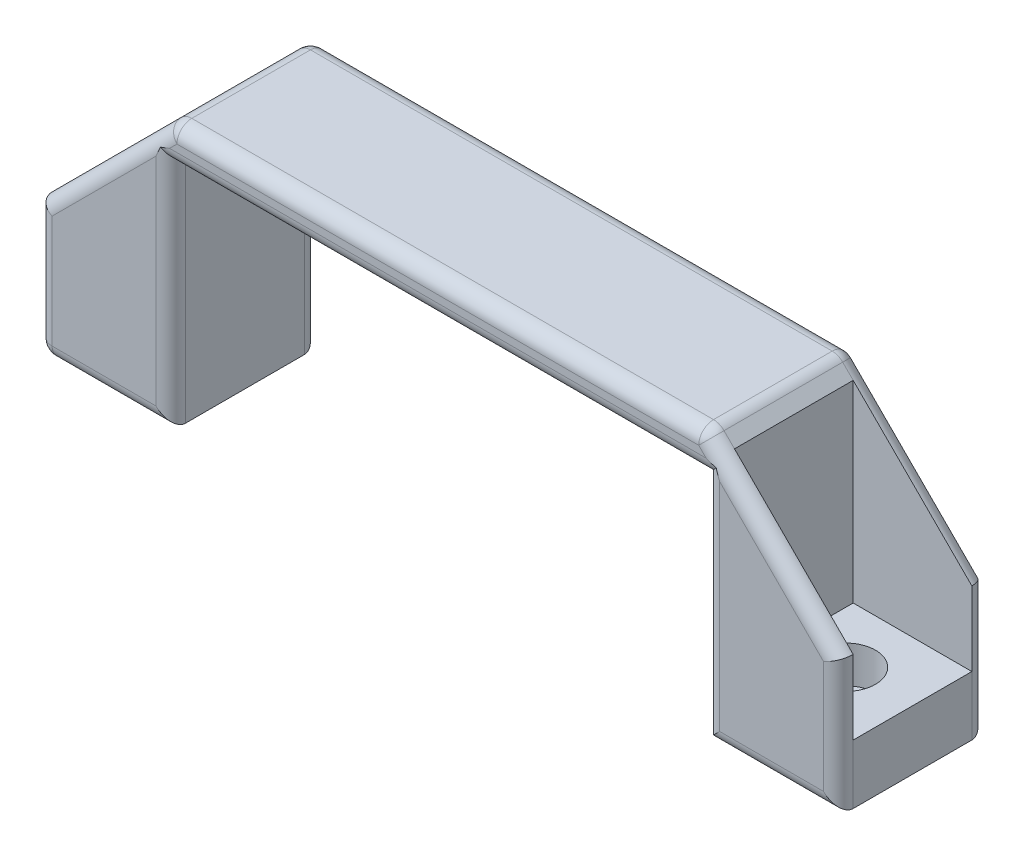
from build123d import *

# Parameters (mm, degrees)
EXTRUDE_1_DEPTH     = 10
SKETCH_2_R          = 2.15
CUT_EXTRUDE_1_DEPTH = 66.665820638
CUT_EXTRUDE_START   = -8
SKETCH_3_W          = 16
SKETCH_3_H          = 16
CUT_EXTRUDE_2_DEPTH = 58.665820638
SKETCH_4_R          = 4
CUT_EXTRUDE_3_DEPTH = 5
FILLET_1_R          = 2


with BuildPart() as part:
    # 草图1 → 凸台-拉伸1 (new, symmetric)
    with BuildSketch(Plane.XY):
        Polygon((-54, 0), (-54, 18), (-36, 36), (36, 36), (54, 18), (54, 0), (36, 0), (36, 31), (-36, 31), (-36, 0), align=None)
    extrude(amount=EXTRUDE_1_DEPTH, both=True)

    # 草图2 → 切除-拉伸1 (cut, through all)
    with BuildSketch(Plane(origin=(0, 0, 0), x_dir=(1, 0, 0), z_dir=(0, 1, 0))):
        with Locations(Location((-45, 0, 0), (0, 0, 180))):
            Circle(SKETCH_2_R)
        with Locations(Location((45, 0, 0), (0, 0, 90))):
            Circle(SKETCH_2_R)
    extrude(amount=CUT_EXTRUDE_1_DEPTH, mode=Mode.SUBTRACT)

    # 草图3 → 切除-拉伸2 (cut, through all)
    with BuildSketch(Plane.XZ.offset(CUT_EXTRUDE_START)):
        with Locations((-46, 0)):
            Rectangle(SKETCH_3_W, SKETCH_3_H)
        with Locations((46, 0)):
            Rectangle(SKETCH_3_W, SKETCH_3_H)
    extrude(amount=-CUT_EXTRUDE_2_DEPTH, mode=Mode.SUBTRACT)

    # 草图4 → 切除-拉伸3 (cut)
    with BuildSketch(Plane(origin=(0, 8, 0), x_dir=(1, 0, 0), z_dir=(0, 1, 0))):
        with Locations(Location((45, 0, 0), (0, 0, 270))):
            Circle(SKETCH_4_R)
        with Locations(Location((-45, 0, 0), (0, 0, 270))):
            Circle(SKETCH_4_R)
    extrude(amount=-CUT_EXTRUDE_3_DEPTH, mode=Mode.SUBTRACT)

    # 圆角1
    # the kernel refuses this fillet: 2 mm, written as the material it takes off along each edge
    with BuildSketch(Plane(origin=(-52, 2, 8), x_dir=(0, -1, 0), z_dir=(-1, 0, 0))) as fillet_1_piece_1_section:
        Polygon((0, 0), (FILLET_1_R, 0), (FILLET_1_R, FILLET_1_R), (0, FILLET_1_R), align=None)
    fillet_1_piece_1 = extrude(amount=FILLET_1_R, mode=Mode.PRIVATE)
    fillet_1_piece_1 = fillet_1_piece_1 - Plane(origin=(-52, 2, 8), x_dir=(0, 0.7071067811865475, -0.7071067811865475), z_dir=(-1, 0, 0)) * Sphere(FILLET_1_R, mode=Mode.PRIVATE)
    add(fillet_1_piece_1, mode=Mode.SUBTRACT)
    with BuildSketch(Plane(origin=(-35.171572875, 34, 8), x_dir=(-0.7071067811865515, 0.7071067811865437, 0), z_dir=(0, 0, 1))) as fillet_1_piece_2_section:
        Polygon((0, 0), (FILLET_1_R, 0), (FILLET_1_R, -FILLET_1_R * 0.414213562373), (FILLET_1_R * 0.707106781187, -FILLET_1_R * 0.707106781187), align=None)
    fillet_1_piece_2 = extrude(amount=FILLET_1_R, mode=Mode.PRIVATE)
    fillet_1_piece_2 = fillet_1_piece_2 - Plane(origin=(-35.171572875, 34, 8), x_dir=(0.38268343236509234, -0.9238795325112857, 0), z_dir=(0, 0, 1)) * Sphere(FILLET_1_R, mode=Mode.PRIVATE)
    add(fillet_1_piece_2, mode=Mode.SUBTRACT)
    with BuildSketch(Plane(origin=(35.171572875, 34, 8), x_dir=(0.7071067811865515, 0.7071067811865437, 0), z_dir=(0, 0, 1))) as fillet_1_piece_3_section:
        Polygon((0, 0), (FILLET_1_R, 0), (FILLET_1_R, FILLET_1_R * 0.414213562373), (FILLET_1_R * 0.707106781187, FILLET_1_R * 0.707106781187), align=None)
    fillet_1_piece_3 = extrude(amount=FILLET_1_R, mode=Mode.PRIVATE)
    fillet_1_piece_3 = fillet_1_piece_3 - Plane(origin=(35.171572875, 34, 8), x_dir=(-0.38268343236509234, -0.9238795325112857, 0), z_dir=(0, 0, 1)) * Sphere(FILLET_1_R, mode=Mode.PRIVATE)
    add(fillet_1_piece_3, mode=Mode.SUBTRACT)
    with BuildSketch(Plane(origin=(35.171572875, 34, -8), x_dir=(0, 1, 0), z_dir=(0, 0, -1))) as fillet_1_piece_4_section:
        Polygon((0, 0), (FILLET_1_R, 0), (FILLET_1_R, FILLET_1_R * 0.414213562373), (FILLET_1_R * 0.707106781187, FILLET_1_R * 0.707106781187), align=None)
    fillet_1_piece_4 = extrude(amount=FILLET_1_R, mode=Mode.PRIVATE)
    fillet_1_piece_4 = fillet_1_piece_4 - Plane(origin=(35.171572875, 34, -8), x_dir=(-0.38268343236509234, -0.9238795325112857, 0), z_dir=(0, 0, -1)) * Sphere(FILLET_1_R, mode=Mode.PRIVATE)
    add(fillet_1_piece_4, mode=Mode.SUBTRACT)
    with BuildSketch(Plane(origin=(-35.171572875, 34, -8), x_dir=(0, 1, 0), z_dir=(0, 0, -1))) as fillet_1_piece_5_section:
        Polygon((0, 0), (FILLET_1_R, 0), (FILLET_1_R, -FILLET_1_R * 0.414213562373), (FILLET_1_R * 0.707106781187, -FILLET_1_R * 0.707106781187), align=None)
    fillet_1_piece_5 = extrude(amount=FILLET_1_R, mode=Mode.PRIVATE)
    fillet_1_piece_5 = fillet_1_piece_5 - Plane(origin=(-35.171572875, 34, -8), x_dir=(0.38268343236509234, -0.9238795325112857, 0), z_dir=(0, 0, -1)) * Sphere(FILLET_1_R, mode=Mode.PRIVATE)
    add(fillet_1_piece_5, mode=Mode.SUBTRACT)
    with BuildSketch(Plane(origin=(-52, 2, -8), x_dir=(0, -1, 0), z_dir=(-1, 0, 0))) as fillet_1_piece_6_section:
        Polygon((0, 0), (FILLET_1_R, 0), (FILLET_1_R, -FILLET_1_R), (0, -FILLET_1_R), align=None)
    fillet_1_piece_6 = extrude(amount=FILLET_1_R, mode=Mode.PRIVATE)
    fillet_1_piece_6 = fillet_1_piece_6 - Plane(origin=(-52, 2, -8), x_dir=(0, 0.7071067811865475, 0.7071067811865475), z_dir=(-1, 0, 0)) * Sphere(FILLET_1_R, mode=Mode.PRIVATE)
    add(fillet_1_piece_6, mode=Mode.SUBTRACT)
    with BuildSketch(Plane(origin=(-54, 2, 10), x_dir=(0, 0, -1), z_dir=(0, 1, 0)), Plane(origin=(-31, 0, 10), x_dir=(0, 0, -1), z_dir=(-1, 0, 0))) as fillet_1_piece_7:
        with BuildLine():
            CenterArc((FILLET_1_R, -FILLET_1_R), FILLET_1_R, 90, 90)
            Line((0, -FILLET_1_R), (0, 0))
            Line((0, 0), (FILLET_1_R, 0))
        make_face()
    extrude(amount=21, mode=Mode.SUBTRACT)
    with BuildSketch(Plane(origin=(-57.535533906, 14.464466094, 10), x_dir=(0.7071067811865515, -0.7071067811865437, 0), z_dir=(0.7071067811865437, 0.7071067811865515, 0)), Plane(origin=(36.585786438, 35.414213562, 10), x_dir=(-0.7071067811865515, -0.7071067811865437, 0), z_dir=(0.7071067811865437, -0.7071067811865515, 0)), Plane(origin=(-57.535533906, 14.464466094, -10), x_dir=(0, 0, 1), z_dir=(0.7071067811865437, 0.7071067811865515, 0))) as fillet_1_piece_8:
        with BuildLine():
            CenterArc((FILLET_1_R, FILLET_1_R), FILLET_1_R, 180, 90)
            Line((0, FILLET_1_R), (0, 0))
            Line((0, 0), (FILLET_1_R, 0))
        make_face()
    extrude(amount=29.627416998, mode=Mode.SUBTRACT)
    with BuildSketch(Plane(origin=(54, 23, 10), x_dir=(-1, 0, 0), z_dir=(0, -1, 0)), Plane(origin=(59, 0, 10), x_dir=(0, 1, 0), z_dir=(-1, 0, 0))) as fillet_1_piece_9:
        with BuildLine():
            CenterArc((FILLET_1_R, FILLET_1_R), FILLET_1_R, 180, 90)
            Line((0, FILLET_1_R), (0, 0))
            Line((0, 0), (FILLET_1_R, 0))
        make_face()
    extrude(amount=28, mode=Mode.SUBTRACT)
    with BuildSketch(Plane(origin=(36, -5, 10), x_dir=(1, 0, 0), z_dir=(0, 1, 0)), Plane(origin=(-36, 31, 10), x_dir=(-1, 0, 0), z_dir=(0, -1, 0))) as fillet_1_piece_10:
        with BuildLine():
            CenterArc((FILLET_1_R, FILLET_1_R), FILLET_1_R, 180, 90)
            Line((0, FILLET_1_R), (0, 0))
            Line((0, 0), (FILLET_1_R, 0))
        make_face()
    extrude(amount=36, mode=Mode.SUBTRACT)
    with BuildSketch(Plane(origin=(36, 31, 10), x_dir=(0, 1, 0), z_dir=(-1, 0, 0))) as fillet_1_piece_11:
        with BuildLine():
            CenterArc((FILLET_1_R, FILLET_1_R), FILLET_1_R, 180, 90)
            Line((0, FILLET_1_R), (0, 0))
            Line((0, 0), (FILLET_1_R, 0))
        make_face()
    extrude(amount=72, mode=Mode.SUBTRACT)
    with BuildSketch(Plane(origin=(-36, 31, -10), x_dir=(-1, 0, 0), z_dir=(0, -1, 0)), Plane(origin=(36, -5, -10), x_dir=(1, 0, 0), z_dir=(0, 1, 0))) as fillet_1_piece_12:
        with BuildLine():
            CenterArc((FILLET_1_R, -FILLET_1_R), FILLET_1_R, 90, 90)
            Line((0, -FILLET_1_R), (0, 0))
            Line((0, 0), (FILLET_1_R, 0))
        make_face()
    extrude(amount=36, mode=Mode.SUBTRACT)
    with BuildSketch(Plane(origin=(36, 31, -10), x_dir=(0, 1, 0), z_dir=(-1, 0, 0))) as fillet_1_piece_13:
        with BuildLine():
            CenterArc((FILLET_1_R, -FILLET_1_R), FILLET_1_R, 90, 90)
            Line((0, -FILLET_1_R), (0, 0))
            Line((0, 0), (FILLET_1_R, 0))
        make_face()
    extrude(amount=72, mode=Mode.SUBTRACT)
    with BuildSketch(Plane(origin=(59, 0, -10), x_dir=(0, 1, 0), z_dir=(-1, 0, 0)), Plane(origin=(54, 23, -10), x_dir=(-1, 0, 0), z_dir=(0, -1, 0))) as fillet_1_piece_14:
        with BuildLine():
            CenterArc((FILLET_1_R, -FILLET_1_R), FILLET_1_R, 90, 90)
            Line((0, -FILLET_1_R), (0, 0))
            Line((0, 0), (FILLET_1_R, 0))
        make_face()
    extrude(amount=28, mode=Mode.SUBTRACT)
    with BuildSketch(Plane(origin=(36.585786438, 35.414213562, -10), x_dir=(-0.7071067811865515, -0.7071067811865437, 0), z_dir=(0.7071067811865437, -0.7071067811865515, 0))) as fillet_1_piece_15:
        with BuildLine():
            CenterArc((FILLET_1_R, -FILLET_1_R), FILLET_1_R, 90, 90)
            Line((0, -FILLET_1_R), (0, 0))
            Line((0, 0), (FILLET_1_R, 0))
        make_face()
    extrude(amount=29.627416998, mode=Mode.SUBTRACT)
    with BuildSketch(Plane(origin=(-54, 2, -10), x_dir=(0, 0, 1), z_dir=(0, 1, 0)), Plane(origin=(-31, 0, -10), x_dir=(0, 0, 1), z_dir=(-1, 0, 0))) as fillet_1_piece_16:
        with BuildLine():
            CenterArc((FILLET_1_R, FILLET_1_R), FILLET_1_R, 180, 90)
            Line((0, FILLET_1_R), (0, 0))
            Line((0, 0), (FILLET_1_R, 0))
        make_face()
    extrude(amount=21, mode=Mode.SUBTRACT)
    with BuildSketch(Plane(origin=(36, 36, 8), x_dir=(-1, 0, 0), z_dir=(0, 0, -1)), Plane(origin=(-36, 36, 8), x_dir=(-0.7071067811865432, -0.7071067811865518, 0), z_dir=(0, 0, -1))) as fillet_1_piece_17:
        with BuildLine():
            CenterArc((FILLET_1_R * 0.414213562373, -FILLET_1_R), FILLET_1_R, 90, 45)
            Line((-FILLET_1_R * 0.292893218813, -FILLET_1_R * 0.292893218813), (0, 0))
            Line((0, 0), (FILLET_1_R * 0.414213562373, 0))
        make_face()
    extrude(amount=16, mode=Mode.SUBTRACT)
    with BuildSketch(Plane(origin=(-35.171572875, 36, 10), x_dir=(0, -1, 0), z_dir=(1, 0, 0))) as fillet_1_piece_18:
        with BuildLine():
            CenterArc((FILLET_1_R, FILLET_1_R), FILLET_1_R, 180, 90)
            Line((0, FILLET_1_R), (0, 0))
            Line((0, 0), (FILLET_1_R, 0))
        make_face()
    extrude(amount=70.343145751, mode=Mode.SUBTRACT)
    with BuildSketch(Plane(origin=(-35.171572875, 36, -10), x_dir=(0, -1, 0), z_dir=(1, 0, 0))) as fillet_1_piece_19:
        with BuildLine():
            CenterArc((FILLET_1_R, -FILLET_1_R), FILLET_1_R, 90, 90)
            Line((0, -FILLET_1_R), (0, 0))
            Line((0, 0), (FILLET_1_R, 0))
        make_face()
    extrude(amount=70.343145751, mode=Mode.SUBTRACT)
    with BuildSketch(Plane(origin=(-54, 0, -8), x_dir=(0, 1, 0), z_dir=(0, 0, 1))) as fillet_1_piece_20:
        with BuildLine():
            CenterArc((FILLET_1_R, -FILLET_1_R), FILLET_1_R, 90, 90)
            Line((0, -FILLET_1_R), (0, 0))
            Line((0, 0), (FILLET_1_R, 0))
        make_face()
    extrude(amount=16, mode=Mode.SUBTRACT)
    with BuildSketch(Plane(origin=(36, -5, 10), x_dir=(1, 0, 0), z_dir=(0, 1, 0))) as fillet_1_piece_21a_section:
        with BuildLine():
            CenterArc((FILLET_1_R, FILLET_1_R), FILLET_1_R, 180, 90)
            Line((0, FILLET_1_R), (0, 0))
            Line((0, 0), (FILLET_1_R, 0))
        make_face()
    fillet_1_piece_21a = extrude(amount=41, mode=Mode.PRIVATE)
    fillet_1_piece_21a = split(fillet_1_piece_21a, bisect_by=Plane(origin=(36.452790229, 31, 9.547209771), z_dir=(0, 1, 0)), keep=Keep.TOP, mode=Mode.PRIVATE)
    with BuildSketch(Plane(origin=(41, 31, 10), x_dir=(0, 1, 0), z_dir=(-1, 0, 0))) as fillet_1_piece_21b_section:
        with BuildLine():
            CenterArc((FILLET_1_R, FILLET_1_R), FILLET_1_R, 180, 90)
            Line((0, FILLET_1_R), (0, 0))
            Line((0, 0), (FILLET_1_R, 0))
        make_face()
    fillet_1_piece_21b = extrude(amount=77, mode=Mode.PRIVATE)
    fillet_1_piece_21b = split(fillet_1_piece_21b, bisect_by=Plane(origin=(36, 31.452790229, 9.547209771), z_dir=(1, 0, 0)), keep=Keep.TOP, mode=Mode.PRIVATE)
    fillet_1_piece_21 = fillet_1_piece_21a & fillet_1_piece_21b
    add(fillet_1_piece_21, mode=Mode.SUBTRACT)
    with BuildSketch(Plane(origin=(36, 31, 10), x_dir=(0, 1, 0), z_dir=(-1, 0, 0))) as fillet_1_piece_22a_section:
        with BuildLine():
            CenterArc((FILLET_1_R, FILLET_1_R), FILLET_1_R, 180, 90)
            Line((0, FILLET_1_R), (0, 0))
            Line((0, 0), (FILLET_1_R, 0))
        make_face()
    fillet_1_piece_22a = extrude(amount=77, mode=Mode.PRIVATE)
    fillet_1_piece_22a = split(fillet_1_piece_22a, bisect_by=Plane(origin=(-36, 31.452790229, 9.547209771), z_dir=(-1, 0, 0)), keep=Keep.TOP, mode=Mode.PRIVATE)
    with BuildSketch(Plane(origin=(-36, 36, 10), x_dir=(-1, 0, 0), z_dir=(0, -1, 0))) as fillet_1_piece_22b_section:
        with BuildLine():
            CenterArc((FILLET_1_R, FILLET_1_R), FILLET_1_R, 180, 90)
            Line((0, FILLET_1_R), (0, 0))
            Line((0, 0), (FILLET_1_R, 0))
        make_face()
    fillet_1_piece_22b = extrude(amount=41, mode=Mode.PRIVATE)
    fillet_1_piece_22b = split(fillet_1_piece_22b, bisect_by=Plane(origin=(-36.452790229, 31, 9.547209771), z_dir=(0, 1, 0)), keep=Keep.TOP, mode=Mode.PRIVATE)
    fillet_1_piece_22 = fillet_1_piece_22a & fillet_1_piece_22b
    add(fillet_1_piece_22, mode=Mode.SUBTRACT)
    with BuildSketch(Plane(origin=(36, 31, -10), x_dir=(0, 1, 0), z_dir=(-1, 0, 0))) as fillet_1_piece_23a_section:
        with BuildLine():
            CenterArc((FILLET_1_R, -FILLET_1_R), FILLET_1_R, 90, 90)
            Line((0, -FILLET_1_R), (0, 0))
            Line((0, 0), (FILLET_1_R, 0))
        make_face()
    fillet_1_piece_23a = extrude(amount=77, mode=Mode.PRIVATE)
    fillet_1_piece_23a = split(fillet_1_piece_23a, bisect_by=Plane(origin=(-36, 31.452790229, -9.547209771), z_dir=(-1, 0, 0)), keep=Keep.TOP, mode=Mode.PRIVATE)
    with BuildSketch(Plane(origin=(-36, 36, -10), x_dir=(-1, 0, 0), z_dir=(0, -1, 0))) as fillet_1_piece_23b_section:
        with BuildLine():
            CenterArc((FILLET_1_R, -FILLET_1_R), FILLET_1_R, 90, 90)
            Line((0, -FILLET_1_R), (0, 0))
            Line((0, 0), (FILLET_1_R, 0))
        make_face()
    fillet_1_piece_23b = extrude(amount=41, mode=Mode.PRIVATE)
    fillet_1_piece_23b = split(fillet_1_piece_23b, bisect_by=Plane(origin=(-36.452790229, 31, -9.547209771), z_dir=(0, 1, 0)), keep=Keep.TOP, mode=Mode.PRIVATE)
    fillet_1_piece_23 = fillet_1_piece_23a & fillet_1_piece_23b
    add(fillet_1_piece_23, mode=Mode.SUBTRACT)
    with BuildSketch(Plane(origin=(36, -5, -10), x_dir=(1, 0, 0), z_dir=(0, 1, 0))) as fillet_1_piece_24a_section:
        with BuildLine():
            CenterArc((FILLET_1_R, -FILLET_1_R), FILLET_1_R, 90, 90)
            Line((0, -FILLET_1_R), (0, 0))
            Line((0, 0), (FILLET_1_R, 0))
        make_face()
    fillet_1_piece_24a = extrude(amount=41, mode=Mode.PRIVATE)
    fillet_1_piece_24a = split(fillet_1_piece_24a, bisect_by=Plane(origin=(36.452790229, 31, -9.547209771), z_dir=(0, 1, 0)), keep=Keep.TOP, mode=Mode.PRIVATE)
    with BuildSketch(Plane(origin=(41, 31, -10), x_dir=(0, 1, 0), z_dir=(-1, 0, 0))) as fillet_1_piece_24b_section:
        with BuildLine():
            CenterArc((FILLET_1_R, -FILLET_1_R), FILLET_1_R, 90, 90)
            Line((0, -FILLET_1_R), (0, 0))
            Line((0, 0), (FILLET_1_R, 0))
        make_face()
    fillet_1_piece_24b = extrude(amount=77, mode=Mode.PRIVATE)
    fillet_1_piece_24b = split(fillet_1_piece_24b, bisect_by=Plane(origin=(36, 31.452790229, -9.547209771), z_dir=(1, 0, 0)), keep=Keep.TOP, mode=Mode.PRIVATE)
    fillet_1_piece_24 = fillet_1_piece_24a & fillet_1_piece_24b
    add(fillet_1_piece_24, mode=Mode.SUBTRACT)


solid = part.part
